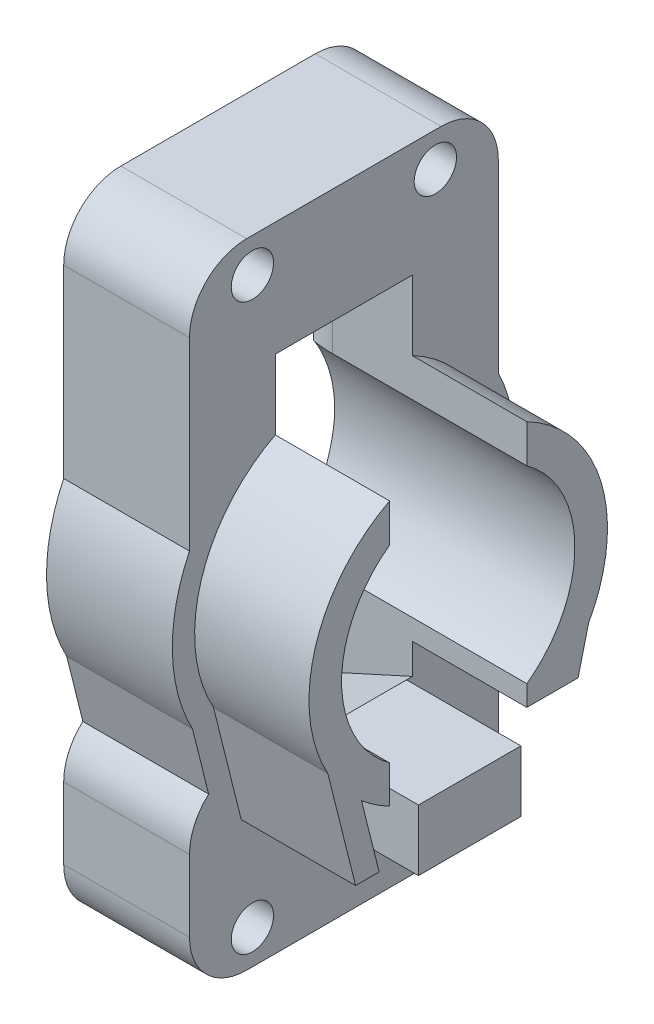
from build123d import *

# Parameters (mm, degrees)
CROQUIS1_R              = 10
SALIENTE_EXTRUIR1_DEPTH = 11
CROQUIS2_R              = 10
SALIENTE_EXTRUIR2_DEPTH = 10
CORTAR_EXTRUIR3_DEPTH   = 10
CROQUIS8_R              = 1.55
CORTAR_EXTRUIR4_DEPTH   = 5
CORTAR_EXTRUIR5_REACH   = 52.656
CORTAR_EXTRUIR6_START   = -10
CORTAR_EXTRUIR6_DEPTH   = 10
SALIENTE_EXTRUIR5_DEPTH = 11
CORTAR_EXTRUIR9_REACH   = 59.413
CROQUIS19_R             = 1.85
SALIENTE_EXTRUIR7_DEPTH = 11
CROQUIS22_W             = 11
CROQUIS22_H             = 5
CORTAR_EXTRUIR10_DEPTH  = 12
CORTAR_EXTRUIR11_DEPTH  = 12
REDONDEO1_R             = 4
REDONDEO2_R             = 5
REDONDEO3_R             = 5


with BuildPart() as part:
    # Croquis1 → Saliente-Extruir1 (new body)
    with BuildSketch(Plane(origin=(0, 0, 0), x_dir=(0, 0, -1), z_dir=(1, 0, 0))):
        with BuildLine():
            Line((-5.780776406, 0), (-24.219223594, 0))
            ThreePointArc((-24.219223594, 0), (-24.834635803, 0.211794562), (-25.189366094, 0.757464375))
            Line((-25.189366094, 0.757464375), (-28.235294118, 12.941176471))
            ThreePointArc((-28.235294118, 12.941176471), (-15, 35), (-1.764705882, 12.941176471))
            Line((-1.764705882, 12.941176471), (-4.810633906, 0.757464375))
            ThreePointArc((-4.810633906, 0.757464375), (-5.165364197, 0.211794562), (-5.780776406, 0))
        make_face()
        with Locations((-15, 20)):
            Circle(CROQUIS1_R, mode=Mode.SUBTRACT)
    extrude(amount=SALIENTE_EXTRUIR1_DEPTH)

    # Croquis2 → Saliente-Extruir2 (add)
    with BuildSketch(Plane(origin=(11, 0, 0), x_dir=(0, 0, -1), z_dir=(1, 0, 0))):
        with BuildLine():
            Line((-23.477486008, 1.95), (-6.522513992, 1.95))
            Line((-6.522513992, 1.95), (-3.59620246, 13.655246131))
            ThreePointArc((-3.59620246, 13.655246131), (-15, 33.05), (-26.40379754, 13.655246131))
            Line((-26.40379754, 13.655246131), (-23.477486008, 1.95))
        make_face()
        with Locations((-15, 20)):
            Circle(CROQUIS2_R, mode=Mode.SUBTRACT)
    extrude(amount=SALIENTE_EXTRUIR2_DEPTH)

    # Croquis3 → Cortar-Extruir3 (cut)
    with BuildSketch(Plane(origin=(21, 0, 0), x_dir=(0, 0, -1), z_dir=(1, 0, 0))):
        Polygon((-9.522513992, 1.95), (-9.522513992, 9.95), (-4.522513992, 9.95), (-6.522513992, 1.95), align=None)
        with BuildLine():
            Line((-23.477486008, 1.95), (-18.477486008, 1.95))
            Line((-18.477486008, 1.95), (-18.477486008, 6.945227656))
            Line((-18.477486008, 6.945227656), (-18.477486008, 7.473743933))
            ThreePointArc((-18.477486008, 7.473743933), (-21.115240601, 8.528128645), (-23.461002355, 10.130276643))
            Line((-23.461002355, 10.130276643), (-23.242071918, 9.254554893))
            Line((-23.242071918, 9.254554893), (-21.915933195, 3.95))
            Line((-21.915933195, 3.95), (-23.977486008, 3.95))
            Line((-23.977486008, 3.95), (-23.477486008, 1.95))
        make_face()
    extrude(amount=-CORTAR_EXTRUIR3_DEPTH, mode=Mode.SUBTRACT)

    # Croquis8 → Cortar-Extruir4 (cut)
    with BuildSketch(Plane.XZ.offset(-1.95)):
        with Locations(Location((16, 14, 0), (0, 0, 270))):
            Circle(CROQUIS8_R)
    extrude(amount=-CORTAR_EXTRUIR4_DEPTH, mode=Mode.SUBTRACT)

    # Cortar-Extruir5: up to this face of the body (flat: up to its plane)
    cortar_extruir5_end = Plane(part.part.faces().sort_by_distance((21, 32.643992611, 15))[0])
    # Croquis11 → Cortar-Extruir5 (cut, up to the picked face)
    with BuildSketch(Plane.ZY, mode=Mode.PRIVATE) as cortar_extruir5_sk1:
        with BuildLine():
            Line((21, 32.7), (9, 32.7))
            Line((9, 32.7), (9, 28.248636251))
            ThreePointArc((9, 28.248636251), (4.8, 20), (9, 11.751363749))
            Line((9, 11.751363749), (9, 7.3))
            Line((9, 7.3), (21, 7.3))
            Line((21, 7.3), (21, 11.751363749))
            ThreePointArc((21, 11.751363749), (25.2, 20), (21, 28.248636251))
            Line((21, 28.248636251), (21, 32.7))
        make_face()
    cortar_extruir5_tool1 = split(extrude(cortar_extruir5_sk1.sketch, amount=-CORTAR_EXTRUIR5_REACH, mode=Mode.PRIVATE), bisect_by=cortar_extruir5_end, keep=Keep.BOTH, mode=Mode.PRIVATE)
    add(cortar_extruir5_tool1.solids().sort_by(Axis((0, 20, 15), (1, 0, 0)))[0], mode=Mode.SUBTRACT)

    # Croquis12 → Cortar-Extruir6 (cut)
    with BuildSketch(Plane(origin=(21, 0, 0), x_dir=(0, 0, -1), z_dir=(1, 0, 0)).offset(CORTAR_EXTRUIR6_START)):
        with BuildLine():
            Line((-18.00208261, 32.7), (-11.99791739, 32.7))
            ThreePointArc((-11.99791739, 32.7), (-15, 33.05), (-18.00208261, 32.7))
        make_face()
    extrude(amount=CORTAR_EXTRUIR6_DEPTH, mode=Mode.SUBTRACT)

    # Croquis18 → Saliente-Extruir5 (add)
    with BuildSketch(Plane.ZY):
        with BuildLine():
            Line((1.5, 7.3), (3.175, 7.3))
            Line((3.175, 7.3), (4.810633906, 0.757464375))
            ThreePointArc((4.810633906, 0.757464375), (5.165364197, 0.211794562), (5.780776406, 0))
            Line((5.780776406, 0), (24.219223594, 0))
            ThreePointArc((24.219223594, 0), (24.834635803, 0.211794562), (25.189366094, 0.757464375))
            Line((25.189366094, 0.757464375), (26.825, 7.3))
            Line((26.825, 7.3), (28.5, 7.3))
            Line((28.5, 7.3), (28.5, -7.7))
            Line((28.5, -7.7), (1.5, -7.7))
            Line((1.5, -7.7), (1.5, 7.3))
        make_face()
        with BuildLine():
            Line((1.5, 47.7), (28.5, 47.7))
            Line((28.5, 47.7), (28.5, 32.7))
            Line((28.5, 32.7), (22.981854421, 32.7))
            ThreePointArc((22.981854421, 32.7), (15, 35), (7.018145579, 32.7))
            Line((7.018145579, 32.7), (1.5, 32.7))
            Line((1.5, 32.7), (1.5, 47.7))
        make_face()
    extrude(amount=-SALIENTE_EXTRUIR5_DEPTH)

    # Croquis19 → Cortar-Extruir9 (cut, up to next)
    with BuildSketch(Plane(origin=(11, 0, 0), x_dir=(0, 0, -1), z_dir=(1, 0, 0)), mode=Mode.PRIVATE) as cortar_extruir9_sk1:
        with Locations((-23, -4.7)):
            Circle(CROQUIS19_R)
    cortar_extruir9_tool1 = extrude(cortar_extruir9_sk1.sketch, amount=-CORTAR_EXTRUIR9_REACH, mode=Mode.PRIVATE) & part.part
    # Croquis19 → Cortar-Extruir9 (cut, up to next)
    with BuildSketch(Plane(origin=(11, 0, 0), x_dir=(0, 0, -1), z_dir=(1, 0, 0)), mode=Mode.PRIVATE) as cortar_extruir9_sk2:
        with Locations(Location((-7, -4.7, 0), (0, 0, 180))):
            Circle(CROQUIS19_R)
    cortar_extruir9_tool2 = extrude(cortar_extruir9_sk2.sketch, amount=-CORTAR_EXTRUIR9_REACH, mode=Mode.PRIVATE) & part.part
    # Croquis19 → Cortar-Extruir9 (cut, up to next)
    with BuildSketch(Plane(origin=(11, 0, 0), x_dir=(0, 0, -1), z_dir=(1, 0, 0)), mode=Mode.PRIVATE) as cortar_extruir9_sk3:
        with Locations((-7, 44.7)):
            Circle(CROQUIS19_R)
    cortar_extruir9_tool3 = extrude(cortar_extruir9_sk3.sketch, amount=-CORTAR_EXTRUIR9_REACH, mode=Mode.PRIVATE) & part.part
    # Croquis19 → Cortar-Extruir9 (cut, up to next)
    with BuildSketch(Plane(origin=(11, 0, 0), x_dir=(0, 0, -1), z_dir=(1, 0, 0)), mode=Mode.PRIVATE) as cortar_extruir9_sk4:
        with Locations(Location((-23, 44.7, 0), (0, 0, 180))):
            Circle(CROQUIS19_R)
    cortar_extruir9_tool4 = extrude(cortar_extruir9_sk4.sketch, amount=-CORTAR_EXTRUIR9_REACH, mode=Mode.PRIVATE) & part.part
    add(cortar_extruir9_tool1.solids().sort_by_distance((11, -4.7, 23))[0], mode=Mode.SUBTRACT)
    add(cortar_extruir9_tool2.solids().sort_by_distance((11, -4.7, 7))[0], mode=Mode.SUBTRACT)
    add(cortar_extruir9_tool3.solids().sort_by_distance((11, 44.7, 7))[0], mode=Mode.SUBTRACT)
    add(cortar_extruir9_tool4.solids().sort_by_distance((11, 44.7, 23))[0], mode=Mode.SUBTRACT)

    # Croquis21 → Saliente-Extruir7 (add)
    with BuildSketch(Plane.ZY):
        with BuildLine():
            Line((22.981854421, 32.7), (28.5, 32.7))
            Line((28.5, 32.7), (28.5, 26.538348415))
            ThreePointArc((28.5, 26.538348415), (26.174032616, 30.007047272), (22.981854421, 32.7))
        make_face()
        with BuildLine():
            Line((1.5, 32.7), (7.018145579, 32.7))
            ThreePointArc((7.018145579, 32.7), (3.825967384, 30.007047272), (1.5, 26.538348415))
            Line((1.5, 26.538348415), (1.5, 32.7))
        make_face()
    extrude(amount=-SALIENTE_EXTRUIR7_DEPTH)

    # Croquis22 → Cortar-Extruir10 (cut)
    with BuildSketch(Plane.XY.offset(9)):
        Polygon((0, 7.3), (0, 2.3), (11, 7.3), align=None)
        with Locations((5.5, 35.2)):
            Rectangle(CROQUIS22_W, CROQUIS22_H)
    extrude(amount=CORTAR_EXTRUIR10_DEPTH, mode=Mode.SUBTRACT)

    # Croquis23 → Cortar-Extruir11 (cut)
    with BuildSketch(Plane.XY.offset(9)):
        Polygon((0, 37.7), (11, 37.7), (0, 41.7), align=None)
    extrude(amount=CORTAR_EXTRUIR11_DEPTH, mode=Mode.SUBTRACT)

    # Redondeo1
    redondeo1_edges = [part.edges().sort_by_distance(p)[0] for p in [
        (0, 34.974318125, 21),
        (0, 34.974318125, 9),
        (0, 7.025681875, 9),
        (0, 7.025681875, 21),
    ]]
    fillet(redondeo1_edges, radius=REDONDEO1_R)

    # Redondeo2
    # the kernel refuses this fillet: 5 mm, written as the material it takes off along each edge
    with BuildSketch(Plane(origin=(-9.335541963, 7.3, 28.5), x_dir=(0, 0, -1), z_dir=(1, 0, 0))) as redondeo2_piece_1:
        with BuildLine():
            CenterArc((5, -3.734216785), REDONDEO2_R, 131.682325393, 48.317674607)
            Line((0, -3.734216785), (-0.1, -3.734216785))
            Line((-0.1, -3.734216785), (-0.1, 0))
            Line((-0.1, 0), (0, 0.1))
            ThreePointArc((0, 0.1), (0.8375, 0.1), (1.6085, 0.074684336))
            Line((1.6085, 0.074684336), (1.675, 0))
        make_face()
    extrude(amount=29.671083927, mode=Mode.SUBTRACT)
    with BuildSketch(Plane(origin=(-9.335541963, 7.3, 1.5), x_dir=(0, -1, 0), z_dir=(1, 0, 0))) as redondeo2_piece_2:
        with BuildLine():
            CenterArc((3.734216785, -5), REDONDEO2_R, 90, 48.317674607)
            Line((0, -1.675), (-0.074684336, -1.6085))
            ThreePointArc((-0.074684336, -1.6085), (-0.1, -0.8375), (-0.1, 0))
            Line((-0.1, 0), (0, 0.1))
            Line((0, 0.1), (3.734216785, 0.1))
            Line((3.734216785, 0.1), (3.734216785, 0))
        make_face()
    extrude(amount=29.671083927, mode=Mode.SUBTRACT)

    # Redondeo3
    redondeo3_edges = [part.edges().sort_by_distance(p)[0] for p in [
        (5.5, -7.7, 1.5),
        (5.5, -7.7, 28.5),
        (5.5, 47.7, 1.5),
        (5.5, 47.7, 28.5),
    ]]
    fillet(redondeo3_edges, radius=REDONDEO3_R)


solid = part.part
